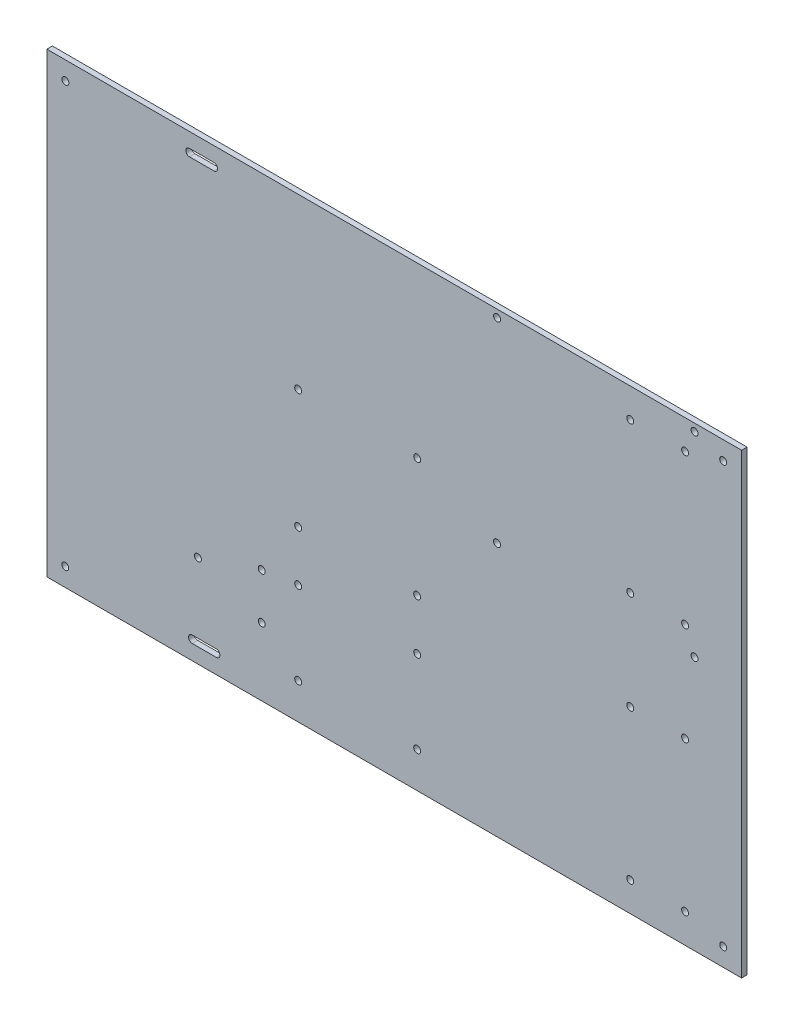
from build123d import *

# Parameters (mm, degrees)
SKETCH1_W                     = 380
SKETCH1_H                     = 250
BASE_FLANGE2_DEPTH            = 3
F_25_0_1495_DIAMETER_SLOT1_D  = 3.7973
F_25_0_1495_DIAMETER_SLOT2_D  = 3.7973
F_25_0_1495_DIAMETER_SLOT3_D  = 3.7973
F_25_0_1495_DIAMETER_SLOT4_D  = 3.7973
F_25_0_1495_DIAMETER_SLOT5_D  = 3.7973
F_25_0_1495_DIAMETER_SLOT6_D  = 3.7973
F_25_0_1495_DIAMETER_SLOT8_D  = 3.7973
F_25_0_1495_DIAMETER_SLOT9_D  = 3.7973
F_25_0_1495_DIAMETER_SLOT10_D = 3.7973
CUT_EXTRUDE1_DEPTH            = 10
CUT_EXTRUDE2_DEPTH            = 10
F_25_0_1495_DIAMETER_SLOT11_D = 3.7973


# Sheet-metal steps are written as plain solids
with BuildPart() as part:
    # Sketch1 → Base-Flange2 (new body)
    with BuildSketch(Plane.XY):
        Rectangle(SKETCH1_W, SKETCH1_H)
    extrude(amount=-BASE_FLANGE2_DEPTH)

    # #25 (0.1495) Diameter Slot1 (through all)
    with Locations(Plane.XY):
        with Locations((179.929815024, 114.924511868)):
            Hole(F_25_0_1495_DIAMETER_SLOT1_D / 2)

    # #25 (0.1495) Diameter Slot2 (through all)
    with Locations(Plane.XY):
        with Locations((179.939600723, -115.063359711)):
            Hole(F_25_0_1495_DIAMETER_SLOT2_D / 2)

    # #25 (0.1495) Diameter Slot3 (through all)
    with Locations(Plane.XY):
        with Locations((-179.960644033, -114.949705326)):
            Hole(F_25_0_1495_DIAMETER_SLOT3_D / 2)

    # #25 (0.1495) Diameter Slot4 (through all)
    with Locations(Plane.XY):
        with Locations((-179.892941698, 115.012185811)):
            Hole(F_25_0_1495_DIAMETER_SLOT4_D / 2)

    # #25 (0.1495) Diameter Slot5 (through all)
    with Locations(Plane.XY):
        with Locations((-52.5501, 32.5501), (-52.5501, -32.5501), (12.5501, -32.5501), (12.5501, 32.5501)):
            Hole(F_25_0_1495_DIAMETER_SLOT5_D / 2)

    # #25 (0.1495) Diameter Slot6 (through all)
    with Locations(Plane.XY):
        with Locations((-107.384209935, -74.531559227), (-72.5, -87.921557802), (-72.5, -62.921557802)):
            Hole(F_25_0_1495_DIAMETER_SLOT6_D / 2)

    # #25 (0.1495) Diameter Slot8 (through all)
    with Locations(Plane.XY):
        with Locations((164.24215408, 120.9), (56.24215408, 120.9), (56.24215408, 14.1), (164.24215408, 14.1)):
            Hole(F_25_0_1495_DIAMETER_SLOT8_D / 2)

    # #25 (0.1495) Diameter Slot9 (through all)
    with Locations(Plane.XY):
        with Locations((-52.5501, -105.440534025), (12.5501, -60.165541974), (-52.5501, -60.165541974)):
            Hole(F_25_0_1495_DIAMETER_SLOT9_D / 2)

    # #25 (0.1495) Diameter Slot10 (through all)
    with Locations(Plane.XY):
        with Locations((12.5501, -105.440534025)):
            Hole(F_25_0_1495_DIAMETER_SLOT10_D / 2)

    # Sketch44 → Cut-Extrude1 (cut)
    with BuildSketch(Plane.XY):
        with BuildLine():
            Line((-110.518294474, -112.786951447), (-97.350647517, -112.786951447))
            ThreePointArc((-97.350647517, -112.786951447), (-95.350647517, -114.786951447), (-97.350647517, -116.786951447))
            Line((-97.350647517, -116.786951447), (-110.518294474, -116.786951447))
            ThreePointArc((-110.518294474, -116.786951447), (-112.518294474, -114.786951447), (-110.518294474, -112.786951447))
        make_face()
    extrude(amount=-CUT_EXTRUDE1_DEPTH, mode=Mode.SUBTRACT)

    # Sketch45 → Cut-Extrude2 (cut)
    with BuildSketch(Plane.XY):
        with BuildLine():
            Line((-112.018294474, 117), (-98.623751671, 117))
            ThreePointArc((-98.623751671, 117), (-96.623751671, 115), (-98.623751671, 113))
            Line((-98.623751671, 113), (-112.018294474, 113))
            ThreePointArc((-112.018294474, 113), (-114.018294474, 115), (-112.018294474, 117))
        make_face()
    extrude(amount=-CUT_EXTRUDE2_DEPTH, mode=Mode.SUBTRACT)

    # #25 (0.1495) Diameter Slot11 (through all)
    with Locations(Plane(origin=(0, 0, -3), x_dir=(-1, 0, 0), z_dir=(0, 0, -1))):
        with Locations((-129.085065503, -27), (-159.085065503, -27), (-159.085065503, -109), (-129.085065503, -109), (-159.085065503, 27), (-129.085065503, 27), (-159.085065503, 109), (-129.085065503, 109)):
            Hole(F_25_0_1495_DIAMETER_SLOT11_D / 2)


solid = part.part
